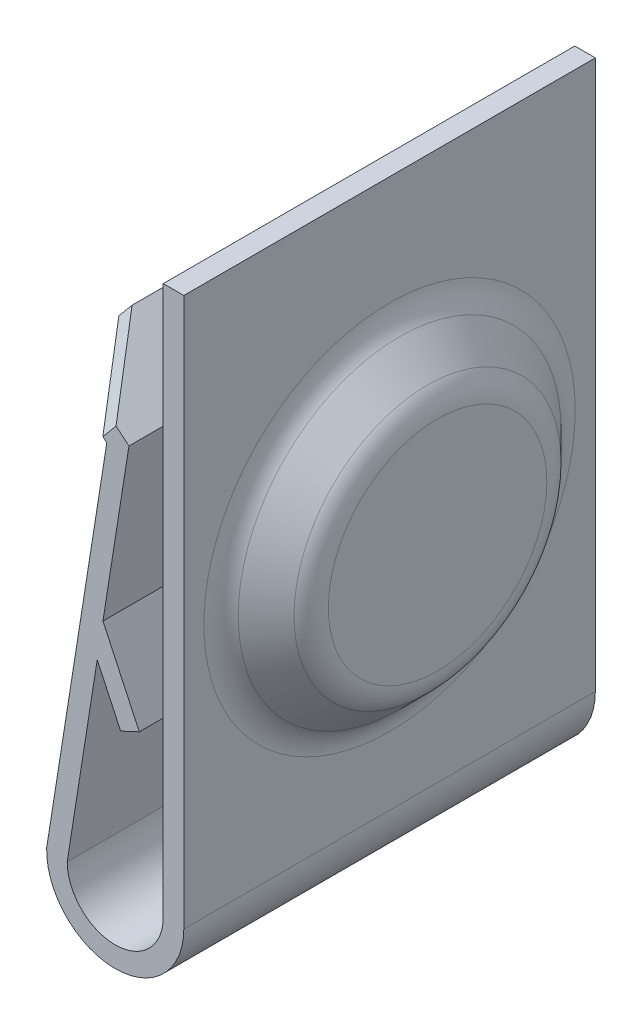
from build123d import *

# Parameters (mm, degrees)
BOSS_EXTRUDE1_DEPTH = 6
CHAMFER1_SIZE       = 1
SKETCH2_R           = 1.5
BOSS_EXTRUDE2_DEPTH = 0.7
CHAMFER2_SIZE       = 1
FILLET1_R           = 0.5
BOSS_EXTRUDE3_DEPTH = 1
BOSS_EXTRUDE4_START = 6
BOSS_EXTRUDE4_DEPTH = 1


with BuildPart() as part:
    # Sketch1 → Boss-Extrude1 (new body)
    with BuildSketch(Plane.XY):
        with BuildLine():
            ThreePointArc((0.3, -8), (-0.712809438, -8.999917956), (-1.699671837, -7.974383226))
            Line((-1.699671837, -7.974383226), (-0.822800703, -2.420866047))
            Line((-0.822800703, -2.420866047), (-1.647054908, -1.729905435))
            Line((-1.647054908, -1.729905435), (-1.454328442, -1.5))
            Line((-1.454328442, -1.5), (-0.5, -2.3))
            Line((-0.5, -2.3), (-1.4, -8))
            ThreePointArc((-1.4, -8), (-0.7, -8.7), (0, -8))
            Line((0, -8), (0, 0))
            Line((0, 0), (0.3, 0))
            Line((0.3, 0), (0.3, -8))
        make_face()
    extrude(amount=BOSS_EXTRUDE1_DEPTH)

    # Chamfer1
    chamfer1_edges = [part.edges().sort_by_distance(p)[0] for p in [
        (-1.550691675, -1.614952718, 0),
        (-1.550691675, -1.614952718, 6),
    ]]
    chamfer(chamfer1_edges, length=CHAMFER1_SIZE)

    # Sketch2 → Boss-Extrude2 (add)
    with BuildSketch(Plane(origin=(0.3, 0, 0), x_dir=(0, 0, -1), z_dir=(1, 0, 0))):
        with Locations((-3, -4.3)):
            Circle(SKETCH2_R)
    extrude(amount=BOSS_EXTRUDE2_DEPTH)

    # Chamfer2
    # the kernel refuses this chamfer: 1 mm, written as the material it adds along each edge
    with BuildSketch(Plane(origin=(0.3, -4.3, 3), x_dir=(0, 0, -1), z_dir=(0, -1, 0))) as chamfer2_piece_1_section:
        Polygon((1.5 + CHAMFER2_SIZE, 0), (1.5, CHAMFER2_SIZE), (1.5, 0), align=None)
    chamfer2_piece_1 = revolve(axis=Axis((0.3, -4.3, 3), (1, 0, 0)), mode=Mode.PRIVATE)
    chamfer2_piece_1 = split(chamfer2_piece_1, bisect_by=Plane(origin=(1, -4.3, 5.151462954), z_dir=(-1, 0, 0)), keep=Keep.TOP, mode=Mode.PRIVATE)
    add(chamfer2_piece_1)

    # Fillet1
    fillet1_edges = [part.edges().sort_by_distance(p)[0] for p in [
        (0.3, -4.3, 5.5),
        (1, -4.3, 4.8),
    ]]
    fillet(fillet1_edges, radius=FILLET1_R)

    # Sketch1<3> → Boss-Extrude3 (add)
    with BuildSketch(Plane.XY):
        Polygon((-0.878934414, -4.699917956), (-0.962606384, -5.229840435), (-0.621188888, -5.961100292), (-0.349357155, -5.83418493), align=None)
    extrude(amount=BOSS_EXTRUDE3_DEPTH)

    # Sketch1<4> → Boss-Extrude4 (add)
    with BuildSketch(Plane.XY.offset(BOSS_EXTRUDE4_START)):
        Polygon((-0.878934414, -4.699917956), (-0.962606384, -5.229840435), (-0.621188888, -5.961100292), (-0.349357155, -5.83418493), align=None)
    extrude(amount=-BOSS_EXTRUDE4_DEPTH)


solid = part.part
